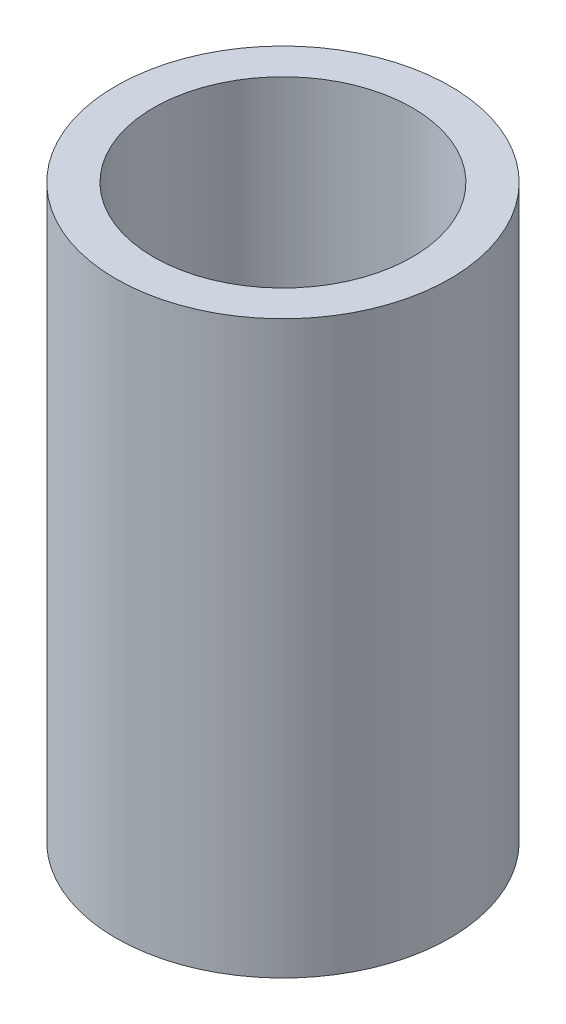
from build123d import *

# Parameters (mm, degrees)
SKETCH1_R           = 17.5
BOSS_EXTRUDE1_DEPTH = 59.810829233
SKETCH2_R           = 13.556209679
CUT_EXTRUDE1_DEPTH  = 65.728937065


with BuildPart() as part:
    # Sketch1 → Boss-Extrude1 (new body)
    with BuildSketch(Plane(origin=(0, 0, 0), x_dir=(1, 0, 0), z_dir=(0, 1, 0))):
        Circle(SKETCH1_R)
    extrude(amount=BOSS_EXTRUDE1_DEPTH)

    # Sketch2 → Cut-Extrude1 (cut, through all)
    with BuildSketch(Plane(origin=(0, 0, 0), x_dir=(1, 0, 0), z_dir=(0, 1, 0))):
        Circle(SKETCH2_R)
    extrude(amount=CUT_EXTRUDE1_DEPTH, mode=Mode.SUBTRACT)


solid = part.part
